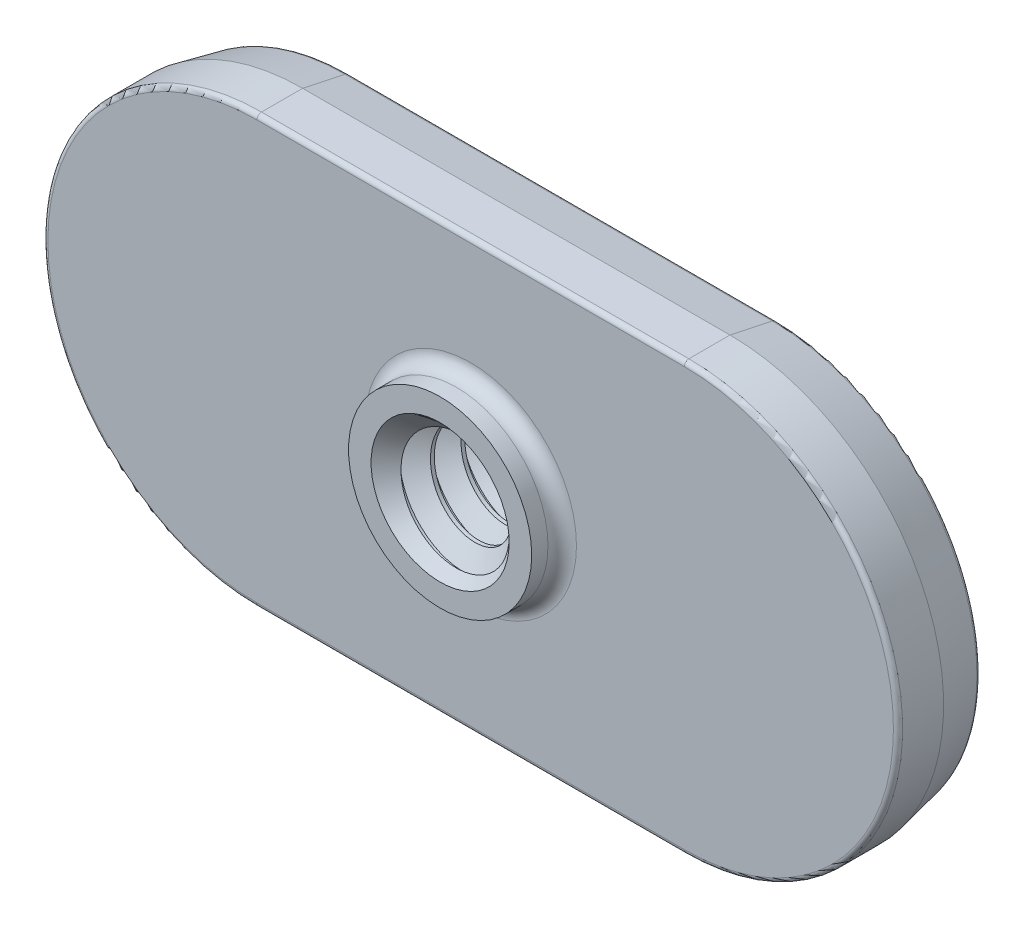
from build123d import *

# Parameters (mm, degrees)
SKETCH3_R                = 1.7526
BOSS_EXTRUDE1_DEPTH      = 2.38125
BOSS_EXTRUDE2_START      = 0.79375
SKETCH4_R                = 2.38125
SKETCH4_R_2              = 1.7526
BOSS_EXTRUDE2_DEPTH      = 0.79375
SKETCH12_OUTSIDE_W       = 35.11
SKETCH12_OUTSIDE_H       = 23.998
CUT_EXTRUDE3_DEPTH       = 13.823423697
CUT_EXTRUDE3_DRAFT       = -12
FILLET1_R                = 0.1190625
FILLET2_R                = 0.370416667
DELETEFACE2_START        = -2.38125
DELETEFACE2_OUTLINE_R    = 1.7526
DELETEFACE2_DEPTH        = 3.175
DELETEFACE2_2_OUTLINE_W  = 8
DELETEFACE2_2_OUTLINE_H  = 8
DELETEFACE2_2_OUTLINE_R  = 1.7526
DELETEFACE2_2_DEPTH      = 0.370416567
BOSS_EXTRUDE3_DEPTH      = 0.79375
BOSS_EXTRUDE3_DEPTH_BACK = 2.38125
SKETCH9_R                = 1.7526
CUT_SWEEP1_PITCH         = 0.79375


# Read off the part's stored shape, not the designer's step: DeleteFace2, Cut-Extrude1
with BuildPart() as part:
    # Sketch3 → Boss-Extrude1 (new body)
    with BuildSketch(Plane.XY):
        with BuildLine():
            Line((5.55625, -5.55625), (-5.55625, -5.55625))
            ThreePointArc((-5.55625, -5.55625), (-11.1125, 0), (-5.55625, 5.55625))
            Line((-5.55625, 5.55625), (5.55625, 5.55625))
            ThreePointArc((5.55625, 5.55625), (11.1125, 0), (5.55625, -5.55625))
        make_face()
        Circle(SKETCH3_R, mode=Mode.SUBTRACT)
    extrude(amount=-BOSS_EXTRUDE1_DEPTH)

    # Sketch4 → Boss-Extrude2 (add)
    with BuildSketch(Plane.XY.offset(BOSS_EXTRUDE2_START)):
        Circle(SKETCH4_R)
        Circle(SKETCH4_R_2, mode=Mode.SUBTRACT)
    extrude(amount=-BOSS_EXTRUDE2_DEPTH)


with BuildPart() as cut_extrude3_tool:
    # Sketch12 outside → Cut-Extrude3 (with draft: the straight prism first)
    with BuildSketch(Plane(origin=(0, 0, -2.38125), x_dir=(-1, 0, 0), z_dir=(0, 0, -1))):
        Rectangle(SKETCH12_OUTSIDE_W, SKETCH12_OUTSIDE_H)
        with BuildLine():
            Line((5.55625, 5.30225), (-5.55625, 5.30225))
            ThreePointArc((-5.55625, 5.30225), (-10.8585, 0), (-5.55625, -5.30225))
            Line((-5.55625, -5.30225), (5.55625, -5.30225))
            ThreePointArc((5.55625, -5.30225), (10.8585, 0), (5.55625, 5.30225))
        make_face(mode=Mode.SUBTRACT)
    extrude(amount=-CUT_EXTRUDE3_DEPTH)
    # Cut-Extrude3: the draft: its side faces are tilted about the plane it starts from
    cut_extrude3_sides = [cut_extrude3_tool.faces().sort_by_distance(p)[0] for p in [
        (0, -11.999, 4.530461848),
        (-17.555, 0, 4.530461848),
        (0, 11.999, 4.530461848),
        (17.555, 0, 4.530461848),
        (-10.8585, 0, 4.530461848),
        (0, -5.30225, 4.530461848),
        (10.8585, 0, 4.530461848),
        (0, 5.30225, 4.530461848),
    ]]
    draft(cut_extrude3_sides, Plane(origin=(0, 0, -2.38125), x_dir=(-1, 0, 0), z_dir=(0, 0, -1)), CUT_EXTRUDE3_DRAFT)


with BuildPart() as part_1:
    add(part.part)

    # Cut-Extrude3: cut by cut_extrude3_tool
    add(cut_extrude3_tool.part, mode=Mode.SUBTRACT)

    # Fillet1
    fillet1_edges = [part_1.edges().sort_by_distance(p)[0] for p in [
        (-10.8585, 0, -2.38125),
        (0, -5.30225, -2.38125),
        (10.8585, 0, -2.38125),
        (0, 5.30225, -2.38125),
        (0, -5.55625, 0),
        (-11.1125, 0, 0),
        (0, 5.55625, 0),
        (11.1125, 0, 0),
    ]]
    fillet(fillet1_edges, radius=FILLET1_R)

    # Fillet2
    fillet2_edges = [part_1.edges().sort_by_distance(p)[0] for p in [
        (-1.7526, 0, -2.38125),
        (-2.38125, 0, 0),
    ]]
    fillet(fillet2_edges, radius=FILLET2_R)

    # DeleteFace2 outline → DeleteFace2 (add)
    with BuildSketch(Plane.XY.offset(DELETEFACE2_START)):
        Circle(DELETEFACE2_OUTLINE_R)
    extrude(amount=DELETEFACE2_DEPTH)

    # DeleteFace2 2 outline → DeleteFace2 2 (add)
    with BuildSketch(Plane.XY.offset(DELETEFACE2_START)):
        Rectangle(DELETEFACE2_2_OUTLINE_W, DELETEFACE2_2_OUTLINE_H)
        Circle(DELETEFACE2_2_OUTLINE_R, mode=Mode.SUBTRACT)
    extrude(amount=DELETEFACE2_2_DEPTH)


with BuildPart() as body_2:
    # Sketch9 → Boss-Extrude3 (new, two sides: drawn at the far end of the back side and taken through both)
    with BuildSketch(Plane.XY.offset(-BOSS_EXTRUDE3_DEPTH_BACK)):
        Circle(SKETCH9_R)
    extrude(amount=BOSS_EXTRUDE3_DEPTH + BOSS_EXTRUDE3_DEPTH_BACK)

    # Cut-Sweep1: the profile of Sketch6 screwed along a right-hand helix of 5 turns, 8 arcs to a turn; built about Z, then put on its axis
    cut_sweep1_z = Axis((0, 0, 0), (0, 0, 1))
    cut_sweep1_corners = [(1.795562979, 0, -0.719335938), (1.795562979, 0, 0.024804687), (1.237044252, 0, -0.29765625), (1.237044252, 0, -0.396875)]
    with BuildLine(mode=Mode.PRIVATE) as cut_sweep1_profile:
        Line(cut_sweep1_corners[0], cut_sweep1_corners[1])
        Line(cut_sweep1_corners[1], cut_sweep1_corners[2])
        Line(cut_sweep1_corners[2], cut_sweep1_corners[3])
        Line(cut_sweep1_corners[3], cut_sweep1_corners[0])
    cut_sweep1_cap = Face(cut_sweep1_profile.wire())
    cut_sweep1_turn_angles = [0, 22.5, 45, 67.5, 90, 112.5, 135, 157.5, 180, 202.5, 225, 247.5, 270, 292.5, 315, 337.5, 360]
    cut_sweep1_turn_weights = [1, 0.9238795325112867, 1, 0.9238795325112867, 1, 0.9238795325112867, 1, 0.9238795325112867, 1, 0.9238795325112867, 1, 0.9238795325112867, 1, 0.9238795325112867, 1, 0.9238795325112867, 1]
    cut_sweep1_turn_rails = [Edge.make_bspline([Vector(p[0], p[1], 0).rotate(cut_sweep1_z, cut_sweep1_turn_angles[k]) / cut_sweep1_turn_weights[k] + Vector(0, 0, p[2] + CUT_SWEEP1_PITCH * cut_sweep1_turn_angles[k] / 360) for k in range(17)], [0, 0, 0, 1, 1, 2, 2, 3, 3, 4, 4, 5, 5, 6, 6, 7, 7, 8, 8, 8], 2, cut_sweep1_turn_weights) for p in cut_sweep1_corners]
    cut_sweep1_turn_sides = [Face.make_surface_from_curves(cut_sweep1_turn_rails[p[0]], cut_sweep1_turn_rails[p[1]]) for p in [(0, 1), (1, 2), (2, 3), (3, 0)]]
    cut_sweep1 = Plane(origin=(0, 0, 0.79375), x_dir=(0, 1, 0), z_dir=(0, 0, -1)) * Solid(Shell([*[p.moved(Location((0, 0, CUT_SWEEP1_PITCH * i))) for i in range(5) for p in cut_sweep1_turn_sides], cut_sweep1_cap, cut_sweep1_cap.rotate(cut_sweep1_z, 1800).moved(Location((0, 0, CUT_SWEEP1_PITCH * 1800 / 360)))]))
    add(cut_sweep1, mode=Mode.SUBTRACT)


with BuildPart() as part_2:
    add(part_1.part)

    # Combine1: cut body 2
    add(body_2.part, mode=Mode.SUBTRACT)

    # Cut-Extrude1 outline → Cut-Extrude1 (revolve, cut)
    with BuildSketch(Plane.XZ):
        Polygon((1.237041048, 0.79375), (1.237041048, 0.235228069), (1.795562979, 0.79375), align=None)
    revolve(axis=Axis((0, 0, 0), (0, 0, 1)), mode=Mode.SUBTRACT)

    # Sketch10 → Cut-Revolve1 (revolve, cut)
    with BuildSketch(Plane(origin=(0, 0, 0), x_dir=(0, 1, 0), z_dir=(-1, 0, 0)), mode=Mode.PRIVATE) as cut_revolve1_sk:
        with BuildLine():
            Line((1.838525958, 2.38125), (1.237044252, 2.38125))
            Line((1.237044252, 2.38125), (1.237044252, 1.779768294))
            ThreePointArc((1.237044252, 1.779768294), (1.413214165, 2.205080087), (1.838525958, 2.38125))
        make_face()
    revolve(cut_revolve1_sk.sketch.rotate(Axis((0, 0, -1.190625), (0, 0, 1)), 90), axis=Axis((0, 0, -1.190625), (0, 0, 1)), mode=Mode.SUBTRACT)

    # Sketch11 → Revolve2 (revolve)
    with BuildSketch(Plane(origin=(0, 0, 0), x_dir=(0, 0, -1), z_dir=(1, 0, 0)), mode=Mode.PRIVATE) as revolve2_sk:
        with BuildLine():
            Line((2.38125, 1.838525958), (1.779768294, 1.838525958))
            Line((1.779768294, 1.838525958), (1.779768294, 1.237044252))
            ThreePointArc((1.779768294, 1.237044252), (2.205080087, 1.413214165), (2.38125, 1.838525958))
        make_face()
    revolve(revolve2_sk.sketch.rotate(Axis((0, 0, -1.190625), (0, 0, 1)), 270), axis=Axis((0, 0, -1.190625), (0, 0, 1)))


solid = part_2.part
